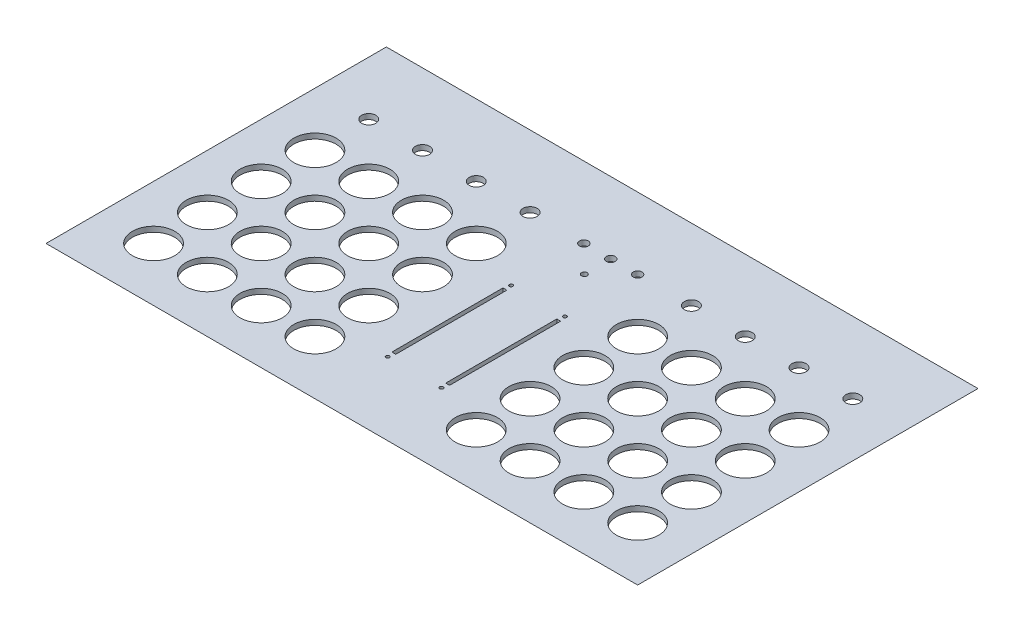
from build123d import *

# Parameters (mm, degrees)
SKETCH2_W           = 335.5
SKETCH2_H           = 193
SKETCH2_R           = 12
SKETCH2_R_2         = 1
SKETCH2_R_3         = 4
SKETCH2_W_2         = 2.2
SKETCH2_H_2         = 63
BOSS_EXTRUDE1_DEPTH = 3
SKETCH3_R           = 2.5
SKETCH3_R_2         = 1.6
CUT_EXTRUDE1_DEPTH  = 10
CHAMFER2_SIZE       = 3


with BuildPart() as part:
    # Sketch2 → Boss-Extrude1 (new body)
    with BuildSketch(Plane(origin=(0, 0, 0), x_dir=(1, 0, 0), z_dir=(0, 1, 0))):
        with Locations((137.25, 66)):
            Rectangle(SKETCH2_W, SKETCH2_H)
        with Locations(Location((0, 0, 0), (0, 0, 270))):
            Circle(SKETCH2_R, mode=Mode.SUBTRACT)
        with Locations(Location((30.5, 0, 0), (0, 0, 270))):
            Circle(SKETCH2_R, mode=Mode.SUBTRACT)
        with Locations(Location((61, 0, 0), (0, 0, 270))):
            Circle(SKETCH2_R, mode=Mode.SUBTRACT)
        with Locations(Location((91.5, 0, 0), (0, 0, 270))):
            Circle(SKETCH2_R, mode=Mode.SUBTRACT)
        with Locations(Location((30.5, 30.5, 0), (0, 0, 270))):
            Circle(SKETCH2_R, mode=Mode.SUBTRACT)
        with Locations(Location((61, 30.5, 0), (0, 0, 270))):
            Circle(SKETCH2_R, mode=Mode.SUBTRACT)
        with Locations(Location((91.5, 30.5, 0), (0, 0, 270))):
            Circle(SKETCH2_R, mode=Mode.SUBTRACT)
        with Locations(Location((30.5, 61, 0), (0, 0, 270))):
            Circle(SKETCH2_R, mode=Mode.SUBTRACT)
        with Locations(Location((61, 61, 0), (0, 0, 270))):
            Circle(SKETCH2_R, mode=Mode.SUBTRACT)
        with Locations(Location((91.5, 61, 0), (0, 0, 270))):
            Circle(SKETCH2_R, mode=Mode.SUBTRACT)
        with Locations(Location((30.5, 91.5, 0), (0, 0, 270))):
            Circle(SKETCH2_R, mode=Mode.SUBTRACT)
        with Locations(Location((61, 91.5, 0), (0, 0, 270))):
            Circle(SKETCH2_R, mode=Mode.SUBTRACT)
        with Locations(Location((91.5, 91.5, 0), (0, 0, 270))):
            Circle(SKETCH2_R, mode=Mode.SUBTRACT)
        with Locations(Location((0, 30.5, 0), (0, 0, 270))):
            Circle(SKETCH2_R, mode=Mode.SUBTRACT)
        with Locations(Location((0, 61, 0), (0, 0, 270))):
            Circle(SKETCH2_R, mode=Mode.SUBTRACT)
        with Locations(Location((0, 91.5, 0), (0, 0, 270))):
            Circle(SKETCH2_R, mode=Mode.SUBTRACT)
        with Locations(Location((122, 80.75, 0), (0, 0, 270))):
            Circle(SKETCH2_R_2, mode=Mode.SUBTRACT)
        with Locations(Location((122, 10.75, 0), (0, 0, 270))):
            Circle(SKETCH2_R_2, mode=Mode.SUBTRACT)
        with Locations(Location((0, 122, 0), (0, 0, 270))):
            Circle(SKETCH2_R_3, mode=Mode.SUBTRACT)
        with Locations(Location((30.5, 122, 0), (0, 0, 270))):
            Circle(SKETCH2_R_3, mode=Mode.SUBTRACT)
        with Locations(Location((61, 122, 0), (0, 0, 270))):
            Circle(SKETCH2_R_3, mode=Mode.SUBTRACT)
        with Locations(Location((91.5, 122, 0), (0, 0, 270))):
            Circle(SKETCH2_R_3, mode=Mode.SUBTRACT)
        with Locations(Location((183, 122, 0), (0, 0, 90))):
            Circle(SKETCH2_R_3, mode=Mode.SUBTRACT)
        with Locations(Location((213.5, 122, 0), (0, 0, 90))):
            Circle(SKETCH2_R_3, mode=Mode.SUBTRACT)
        with Locations(Location((244, 122, 0), (0, 0, 90))):
            Circle(SKETCH2_R_3, mode=Mode.SUBTRACT)
        with Locations(Location((274.5, 122, 0), (0, 0, 90))):
            Circle(SKETCH2_R_3, mode=Mode.SUBTRACT)
        with Locations(Location((152.5, 10.75, 0), (0, 0, 90))):
            Circle(SKETCH2_R_2, mode=Mode.SUBTRACT)
        with Locations(Location((152.5, 80.75, 0), (0, 0, 90))):
            Circle(SKETCH2_R_2, mode=Mode.SUBTRACT)
        with Locations(Location((274.5, 91.5, 0), (0, 0, 90))):
            Circle(SKETCH2_R, mode=Mode.SUBTRACT)
        with Locations(Location((274.5, 61, 0), (0, 0, 90))):
            Circle(SKETCH2_R, mode=Mode.SUBTRACT)
        with Locations(Location((274.5, 30.5, 0), (0, 0, 90))):
            Circle(SKETCH2_R, mode=Mode.SUBTRACT)
        with Locations(Location((183, 91.5, 0), (0, 0, 90))):
            Circle(SKETCH2_R, mode=Mode.SUBTRACT)
        with Locations(Location((213.5, 91.5, 0), (0, 0, 90))):
            Circle(SKETCH2_R, mode=Mode.SUBTRACT)
        with Locations(Location((244, 91.5, 0), (0, 0, 90))):
            Circle(SKETCH2_R, mode=Mode.SUBTRACT)
        with Locations(Location((183, 61, 0), (0, 0, 90))):
            Circle(SKETCH2_R, mode=Mode.SUBTRACT)
        with Locations(Location((213.5, 61, 0), (0, 0, 90))):
            Circle(SKETCH2_R, mode=Mode.SUBTRACT)
        with Locations(Location((244, 61, 0), (0, 0, 90))):
            Circle(SKETCH2_R, mode=Mode.SUBTRACT)
        with Locations(Location((183, 30.5, 0), (0, 0, 90))):
            Circle(SKETCH2_R, mode=Mode.SUBTRACT)
        with Locations(Location((213.5, 30.5, 0), (0, 0, 90))):
            Circle(SKETCH2_R, mode=Mode.SUBTRACT)
        with Locations(Location((244, 30.5, 0), (0, 0, 90))):
            Circle(SKETCH2_R, mode=Mode.SUBTRACT)
        with Locations(Location((183, 0, 0), (0, 0, 90))):
            Circle(SKETCH2_R, mode=Mode.SUBTRACT)
        with Locations(Location((213.5, 0, 0), (0, 0, 90))):
            Circle(SKETCH2_R, mode=Mode.SUBTRACT)
        with Locations(Location((244, 0, 0), (0, 0, 90))):
            Circle(SKETCH2_R, mode=Mode.SUBTRACT)
        with Locations(Location((274.5, 0, 0), (0, 0, 90))):
            Circle(SKETCH2_R, mode=Mode.SUBTRACT)
        with Locations((122, 45.75)):
            Rectangle(SKETCH2_W_2, SKETCH2_H_2, mode=Mode.SUBTRACT)
        with Locations((152.5, 45.75)):
            Rectangle(SKETCH2_W_2, SKETCH2_H_2, mode=Mode.SUBTRACT)
    extrude(amount=BOSS_EXTRUDE1_DEPTH)

    # Sketch3 → Cut-Extrude1 (cut)
    with BuildSketch(Plane(origin=(0, 3, 0), x_dir=(1, 0, 0), z_dir=(0, 1, 0))):
        with Locations(Location((122, 122, 0), (0, 0, 270))):
            Circle(SKETCH3_R)
        with Locations(Location((137.25, 122, 0), (0, 0, 270))):
            Circle(SKETCH3_R)
        with Locations(Location((152.5, 122, 0), (0, 0, 270))):
            Circle(SKETCH3_R)
        with Locations(Location((137.25, 107, 0), (0, 0, 270))):
            Circle(SKETCH3_R_2)
    extrude(amount=-CUT_EXTRUDE1_DEPTH, mode=Mode.SUBTRACT)

    # Chamfer2
    chamfer2_edges = [part.edges().sort_by_distance(p)[0] for p in [
        (-30.5, 0, -66),
        (137.25, 0, 30.5),
        (305, 0, -66),
        (137.25, 0, -162.5),
    ]]
    chamfer(chamfer2_edges, length=CHAMFER2_SIZE - 0.0001)  # a hair under: the kernel refuses the full size


solid = part.part
